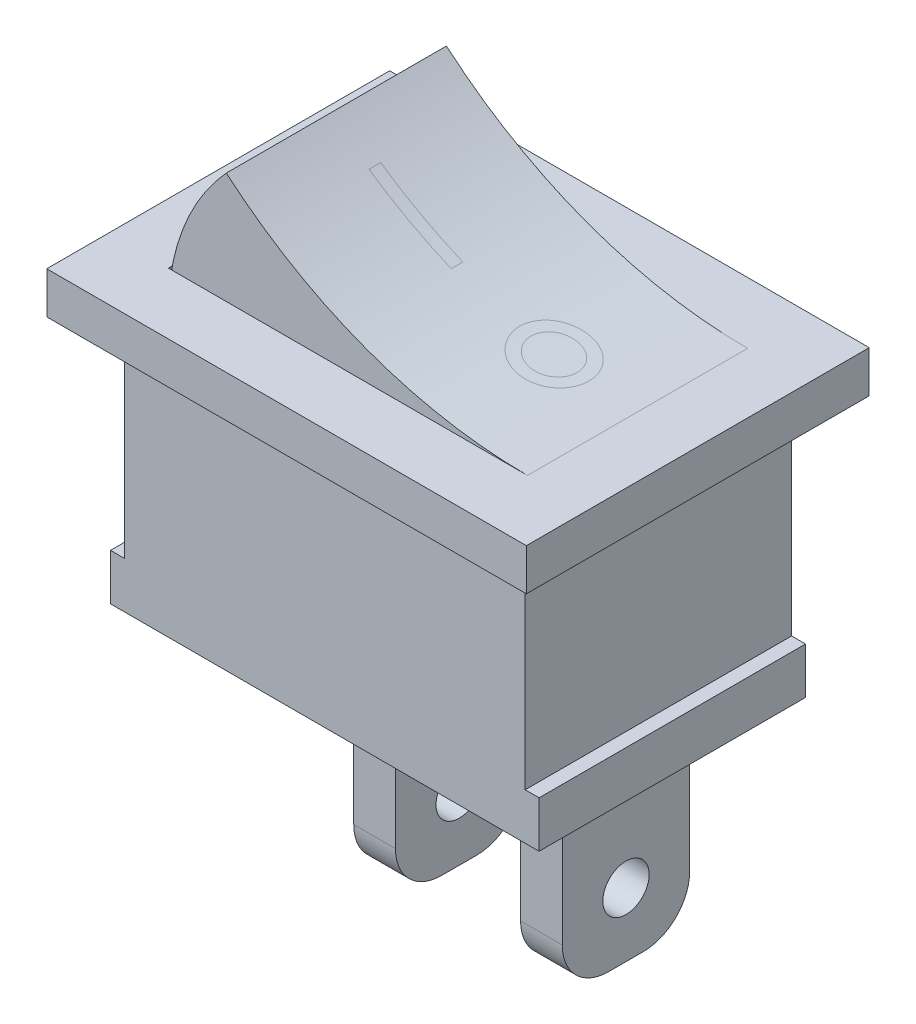
from build123d import *

# Parameters (mm, degrees)
SALIENTE_EXTRUIR1_DEPTH             = 5.75
CROQUIS2_W                          = 20.7
CROQUIS2_H                          = 14.8
SALIENTE_EXTRUIR2_DEPTH             = 1.8
CROQUIS3_W                          = 15.5
CROQUIS3_H                          = 9.5
CORTAR_EXTRUIR1_DEPTH               = 1.8
SALIENTE_EXTRUIR3_REACH             = 16.287
SALIENTE_EXTRUIR3_DIRECTION_2_REACH = 16.287
CROQUIS7_W                          = 1.8
CROQUIS7_H                          = 8
SALIENTE_EXTRUIR4_DEPTH             = 2.75
SALIENTE_EXTRUIR4_2_DEPTH           = 2.75
REDONDEO1_R                         = 2
REDONDEO2_R                         = 2
CROQUIS9_R                          = 1
CORTAR_EXTRUIR2_DEPTH               = 24.974361305


with BuildPart() as part:
    # Croquis1 → Saliente-Extruir1 (new, symmetric)
    with BuildSketch(Plane.XY):
        Polygon((8.65, -4.5), (9.25, -4.5), (9.25, -6.5), (-9.25, -6.5), (-9.25, -4.5), (-8.65, -4.5), (-8.65, 4.5), (8.65, 4.5), align=None)
    extrude(amount=SALIENTE_EXTRUIR1_DEPTH, both=True)

    # Croquis2 → Saliente-Extruir2 (add)
    with BuildSketch(Plane(origin=(0, 4.5, 0), x_dir=(1, 0, 0), z_dir=(0, 1, 0))):
        Rectangle(CROQUIS2_W, CROQUIS2_H)
    extrude(amount=SALIENTE_EXTRUIR2_DEPTH)

    # Croquis3 → Cortar-Extruir1 (cut)
    with BuildSketch(Plane(origin=(0, 6.3, 0), x_dir=(1, 0, 0), z_dir=(0, 1, 0))):
        Rectangle(CROQUIS3_W, CROQUIS3_H)
    extrude(amount=-CORTAR_EXTRUIR1_DEPTH, mode=Mode.SUBTRACT)


with BuildPart() as body_2:

    # Saliente-Extruir3: up to this face of the body (flat: up to its plane)
    saliente_extruir3_end = Plane(part.part.faces().sort_by_distance((0, 5.4, 4.75))[0])
    # Croquis4 → Saliente-Extruir3 (new, up to the picked face)
    with BuildSketch(Plane.XY, mode=Mode.PRIVATE) as saliente_extruir3_sk1:
        with BuildLine():
            Line((7.75, 4.5), (-7.75, 4.5))
            ThreePointArc((-7.75, 4.5), (-7.13588418, 8.041475131), (-5.25, 11.101315846))
            ThreePointArc((-5.25, 11.101315846), (0.820847204, 7.538687638), (7.75, 6.3))
            Line((7.75, 6.3), (7.75, 4.5))
        make_face()
    saliente_extruir3_tool1 = split(extrude(saliente_extruir3_sk1.sketch, amount=SALIENTE_EXTRUIR3_REACH, mode=Mode.PRIVATE), bisect_by=saliente_extruir3_end, keep=Keep.BOTH, mode=Mode.PRIVATE)
    add(saliente_extruir3_tool1.solids().sort_by(Axis((-1.534706, 6.575986, 0), (0, 0, 1)))[0])


    # Saliente-Extruir3 direction 2: up to this face of the body (flat: up to its plane)
    saliente_extruir3_direction_2_end = Plane(part.part.faces().sort_by_distance((0, 5.4, -4.75))[0])
    # Croquis4 → Saliente-Extruir3 direction 2 (add, up to the picked face)
    with BuildSketch(Plane.XY, mode=Mode.PRIVATE) as saliente_extruir3_direction_2_sk1:
        with BuildLine():
            Line((7.75, 4.5), (-7.75, 4.5))
            ThreePointArc((-7.75, 4.5), (-7.13588418, 8.041475131), (-5.25, 11.101315846))
            ThreePointArc((-5.25, 11.101315846), (0.820847204, 7.538687638), (7.75, 6.3))
            Line((7.75, 6.3), (7.75, 4.5))
        make_face()
    saliente_extruir3_direction_2_tool1 = split(extrude(saliente_extruir3_direction_2_sk1.sketch, amount=-SALIENTE_EXTRUIR3_DIRECTION_2_REACH, mode=Mode.PRIVATE), bisect_by=saliente_extruir3_direction_2_end, keep=Keep.BOTH, mode=Mode.PRIVATE)
    add(saliente_extruir3_direction_2_tool1.solids().sort_by(Axis((-1.534706, 6.575986, 0), (0, 0, -1)))[0])


with BuildPart() as body_3:
    # Croquis7 → Saliente-Extruir4 (new, symmetric)
    with BuildSketch(Plane.XY):
        with Locations((6.35, -10.5)):
            Rectangle(CROQUIS7_W, CROQUIS7_H)
    extrude(amount=SALIENTE_EXTRUIR4_DEPTH, both=True)

    # Redondeo2
    redondeo2_edges = [body_3.edges().sort_by_distance(p)[0] for p in [
        (6.35, -14.5, -2.75),
        (6.35, -14.5, 2.75),
    ]]
    fillet(redondeo2_edges, radius=REDONDEO2_R)


with BuildPart() as body_4:
    # Croquis7 → Saliente-Extruir4 2 (new, symmetric)
    with BuildSketch(Plane.XY):
        with Locations((-0.85, -10.5)):
            Rectangle(CROQUIS7_W, CROQUIS7_H)
    extrude(amount=SALIENTE_EXTRUIR4_2_DEPTH, both=True)

    # Redondeo1
    redondeo1_edges = [body_4.edges().sort_by_distance(p)[0] for p in [
        (-0.85, -14.5, -2.75),
        (-0.85, -14.5, 2.75),
    ]]
    fillet(redondeo1_edges, radius=REDONDEO1_R)


with BuildPart() as cortar_extruir2_tool:
    # Croquis9 → Cortar-Extruir2 (new, through all)
    with BuildSketch(Plane(origin=(7.25, 0, 0), x_dir=(0, 0, -1), z_dir=(1, 0, 0))):
        with Locations((0, -11.739625203)):
            Circle(CROQUIS9_R)
    extrude(amount=-CORTAR_EXTRUIR2_DEPTH)


with BuildPart() as body_3_1:
    add(body_3.part)

    # Cortar-Extruir2: cut by cortar_extruir2_tool
    add(cortar_extruir2_tool.part, mode=Mode.SUBTRACT)


with BuildPart() as body_4_1:
    add(body_4.part)

    # Cortar-Extruir2: cut by cortar_extruir2_tool
    add(cortar_extruir2_tool.part, mode=Mode.SUBTRACT)


solid = Compound([part.part, body_2.part, body_3_1.part, body_4_1.part])
